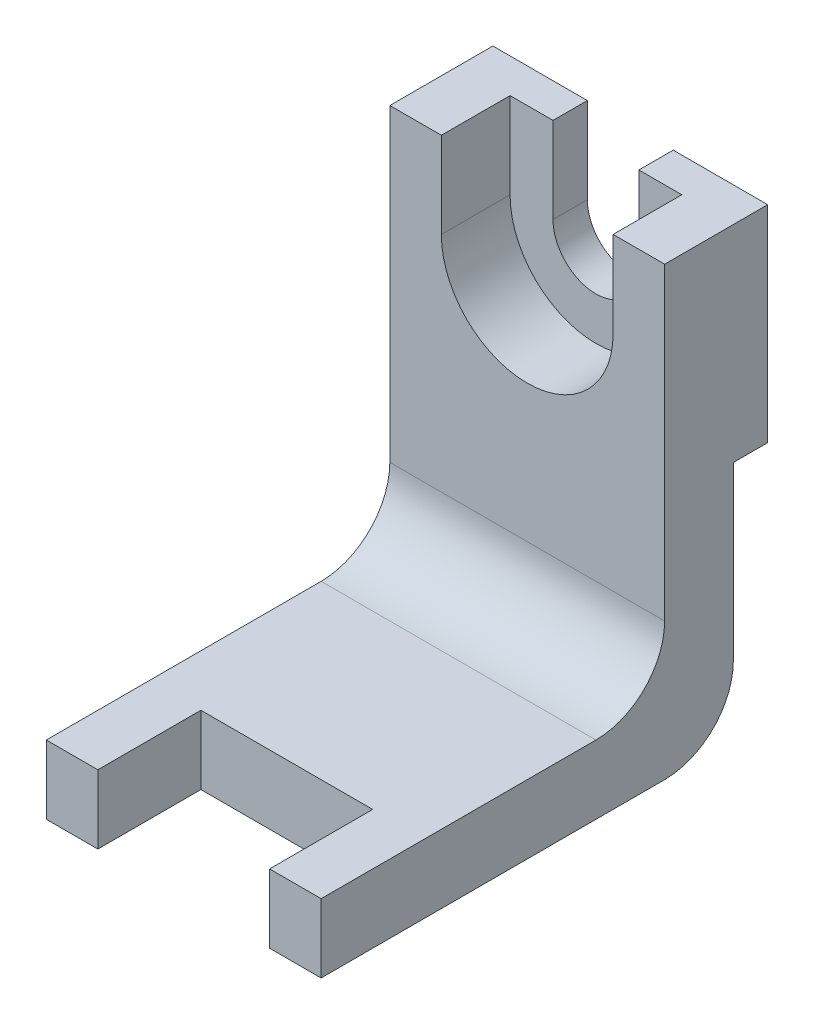
from build123d import *

# Parameters (mm, degrees)
SKETCH_1_W          = 16
SKETCH_1_H          = 26
EXTRUDE_1_DEPTH     = 4
SKETCH_2_W          = 16
SKETCH_2_H          = 4
EXTRUDE_2_DEPTH     = 20
SKETCH_3_W          = 16
SKETCH_3_H          = 12
EXTRUDE_3_DEPTH     = 2
FILLET_2_R          = 4
FILLET_START        = -8
FILLET_3_DEPTH      = 16
SKETCH_4_W          = 10
SKETCH_4_H          = 6
CUT_EXTRUDE_2_DEPTH = 34.520714063
CUT_EXTRUDE_3_DEPTH = 4
CUT_EXTRUDE_4_DEPTH = 2


with BuildPart() as part:
    # Эскиз1 → Бобышка-Вытянуть1 (new body)
    with BuildSketch(Plane.XY):
        Rectangle(SKETCH_1_W, SKETCH_1_H)
    extrude(amount=EXTRUDE_1_DEPTH)

    # Эскиз2 → Бобышка-Вытянуть2 (add)
    with BuildSketch(Plane.XY.offset(4)):
        with Locations((0, -10.991777356)):
            Rectangle(SKETCH_2_W, SKETCH_2_H)
    extrude(amount=EXTRUDE_2_DEPTH)

    # Эскиз3 → Бобышка-Вытянуть3 (add)
    with BuildSketch(Plane(origin=(0, 0, 0), x_dir=(-1, 0, 0), z_dir=(0, 0, -1))):
        with Locations((0, 7)):
            Rectangle(SKETCH_3_W, SKETCH_3_H)
    extrude(amount=EXTRUDE_3_DEPTH)

    # Скругление2
    fillet_2_edges = [part.edges().sort_by_distance(p)[0] for p in [
        (0, -8.991777356, 4),
    ]]
    fillet(fillet_2_edges, radius=FILLET_2_R)

    # Скругление3: read off the stored shape, not the designer's step
    # Скругление3 outline → Скругление3 (cut)
    with BuildSketch(Plane.YZ.offset(FILLET_START)):
        with BuildLine():
            ThreePointArc((-8.991777356, 0), (-11.820204481, 1.171572875), (-12.991777356, 4))
            Line((-12.991777356, 4), (-13, 4))
            Line((-13, 4), (-13, 0))
            Line((-13, 0), (-8.991777356, 0))
        make_face()
    extrude(amount=FILLET_3_DEPTH, mode=Mode.SUBTRACT)

    # Эскиз4 → Вырез-Вытянуть2 (cut, through all)
    with BuildSketch(Plane(origin=(0, -8.991777356, 0), x_dir=(1, 0, 0), z_dir=(0, 1, 0))):
        with Locations((0, -21)):
            Rectangle(SKETCH_4_W, SKETCH_4_H)
    extrude(amount=-CUT_EXTRUDE_2_DEPTH, mode=Mode.SUBTRACT)

    # Эскиз5 → Вырез-Вытянуть3 (cut)
    with BuildSketch(Plane.XY.offset(4)):
        with BuildLine():
            Line((-5, 13), (-5, 8))
            ThreePointArc((-5, 8), (0, 3), (5, 8))
            Line((5, 8), (5, 13))
            Line((5, 13), (-5, 13))
        make_face()
    extrude(amount=-CUT_EXTRUDE_3_DEPTH, mode=Mode.SUBTRACT)

    # Эскиз7 → Вырез-Вытянуть4 (cut)
    with BuildSketch(Plane.XY):
        with BuildLine():
            Line((-2.5, 13), (-2.5, 8))
            ThreePointArc((-2.5, 8), (0, 5.5), (2.5, 8))
            Line((2.5, 8), (2.5, 13))
            Line((2.5, 13), (-2.5, 13))
        make_face()
    extrude(amount=-CUT_EXTRUDE_4_DEPTH, mode=Mode.SUBTRACT)


solid = part.part
